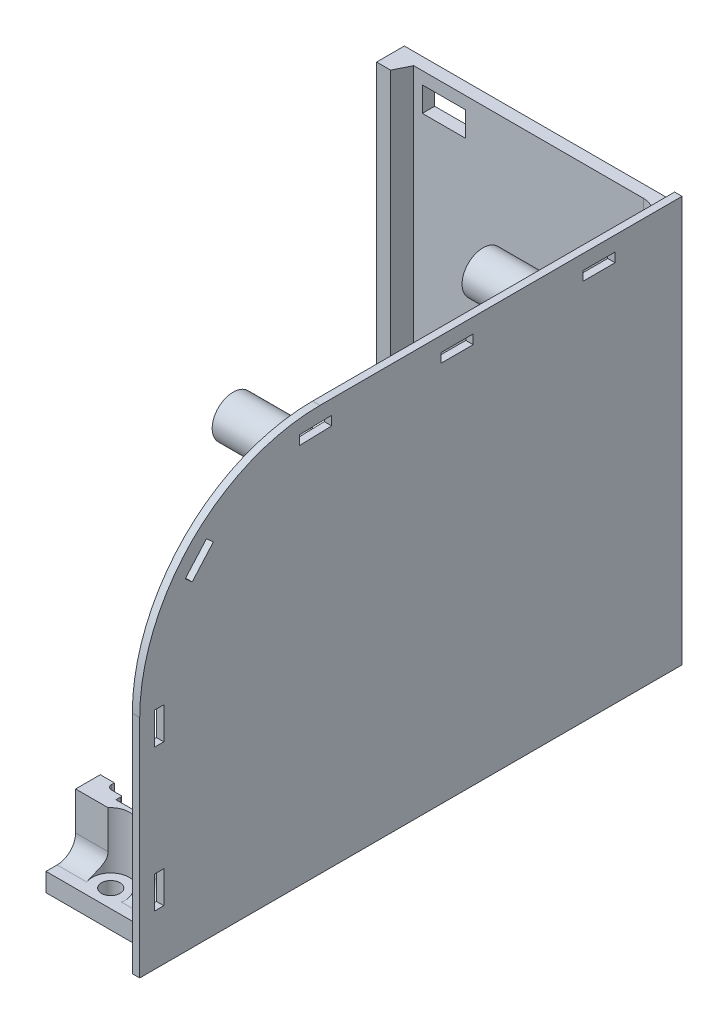
from build123d import *

# Parameters (mm, degrees)
EXTRUDE_1_DEPTH     = 2
EXTRUDE_2_DEPTH     = 1.2
SKETCH_4_R          = 1.55
EXTRUDE_3_DEPTH     = 4
EXTRUDE_START       = 3
SKETCH_4_3_R        = 1.55
EXTRUDE_4_DEPTH     = 4
FILLET_1_R          = 3
SKETCH_5_W          = 3.5
SKETCH_5_H          = 2.5
EXTRUDE_5_DEPTH     = 59.375418161
SKETCH_9_W          = 7
SKETCH_9_H          = 4
CUT_EXTRUDE_3_DEPTH = 2
OTHER_START         = -350.004341608
OTHER_1_OUTLINE_W   = 1.5
OTHER_1_OUTLINE_H   = 5.2
OTHER_1_OUTLINE_W_2 = 5.2
OTHER_1_OUTLINE_H_2 = 1.5
OTHER_1_DEPTH       = 1.2
SKETCH_10_R         = 3.4
SKETCH_10_R_2       = 1.4
EXTRUDE_6_DEPTH     = 13.8
EXTRUDE_7_DEPTH     = 2.4
CHAMFER_1_SIZE2     = 1.219331471
CHAMFER_1_SIZE      = 2.5
EXTRUDE_9_DEPTH     = 15.389983971
SKETCH_15_R         = 1.5
CUT_EXTRUDE_4_DEPTH = 407.679532375
FILLET_2_R          = 3
SKETCH_16_R         = 3
CUT_EXTRUDE_5_DEPTH = 408.922716855


# Read off the part's stored shape, not the designer's step: Отступ1
# Some blends are built 0.0001 mm under size
with BuildPart() as part:
    # Эскиз2 → Бобышка-Вытянуть1 (new body)
    with BuildSketch(Plane.XY.offset(0.1)):
        Polygon((-376.904341608, -14.952219826), (-393.804341608, -14.952219826), (-393.804341608, 44.423198335), (-348.804341608, 44.423198335), (-348.804341608, -19.952219826), (-376.904341608, -19.952219826), align=None)
    extrude(amount=EXTRUDE_1_DEPTH)

    # Эскиз3 → Бобышка-Вытянуть2 (add)
    with BuildSketch(Plane(origin=(-348.804341608, 0, 0), x_dir=(0, 0, -1), z_dir=(1, 0, 0))):
        with BuildLine():
            Line((-0.1, -19.952219826), (-0.1, 45.823198335))
            Line((-0.1, 45.823198335), (-58.7849644, 45.823198335))
            ThreePointArc((-58.7849644, 45.823198335), (-79.43775717, 37.268531468), (-87.992424037, 16.615738698))
            Line((-87.992424037, 16.615738698), (-87.992424037, -19.952219826))
            Line((-87.992424037, -19.952219826), (-0.1, -19.952219826))
        make_face()
    extrude(amount=-EXTRUDE_2_DEPTH)

    # Эскиз4 → Бобышка-Вытянуть3 (add)
    with BuildSketch(Plane(origin=(0, -17.952219826, 0), x_dir=(1, 0, 0), z_dir=(0, 1, 0))):
        with BuildLine():
            Line((-357.604341608, -2.1), (-357.604341608, -5.7))
            ThreePointArc((-357.604341608, -5.7), (-356.608504664, -8.104163056), (-354.204341608, -9.1))
            Line((-354.204341608, -9.1), (-350.004341608, -9.1))
            Line((-350.004341608, -9.1), (-350.004341608, -2.1))
            Line((-350.004341608, -2.1), (-357.604341608, -2.1))
        make_face()
        with Locations(Location((-354.204341608, -5.7, 0), (0, 0, 270))):
            Circle(SKETCH_4_R, mode=Mode.SUBTRACT)
    extrude(amount=EXTRUDE_3_DEPTH)

    # Эскиз4<3> → Бобышка-Вытянуть4 (add)
    with BuildSketch(Plane(origin=(0, -17.952219826, 0), x_dir=(1, 0, 0), z_dir=(0, 1, 0)).offset(EXTRUDE_START)):
        with BuildLine():
            Line((-390.304341608, -5.7), (-390.304341608, -2.1))
            Line((-390.304341608, -2.1), (-381.365657691, -2.1))
            Line((-381.365657691, -2.1), (-383.84844185, -7.190461899))
            ThreePointArc((-383.84844185, -7.190461899), (-387.669175192, -9.01285822), (-390.304341608, -5.7))
        make_face()
        with Locations(Location((-386.904341608, -5.7, 0), (0, 0, 180))):
            Circle(SKETCH_4_3_R, mode=Mode.SUBTRACT)
    extrude(amount=EXTRUDE_4_DEPTH)

    # Скругление1
    fillet_1_edges = [part.edges().sort_by_distance(p)[0] for p in [
        (-350.004341608, -18.952219826, 2.1),
        (-350.004341608, 15.235489254, 2.1),
    ]]
    fillet(fillet_1_edges, radius=FILLET_1_R)

    # Эскиз5 → Бобышка-Вытянуть5 (add)
    with BuildSketch(Plane(origin=(0, 44.423198335, 0), x_dir=(1, 0, 0), z_dir=(0, 1, 0))):
        with Locations((-392.054341608, -3.35)):
            Rectangle(SKETCH_5_W, SKETCH_5_H)
    extrude(amount=-EXTRUDE_5_DEPTH)

    # Эскиз9 → Вырез-Вытянуть3 (cut)
    with BuildSketch(Plane(origin=(0, 0, 0.1), x_dir=(-1, 0, 0), z_dir=(0, 0, -1))):
        with Locations((385.390488384, 40.423198335)):
            Rectangle(SKETCH_9_W, SKETCH_9_H)
    extrude(amount=-CUT_EXTRUDE_3_DEPTH, mode=Mode.SUBTRACT)

    # Отступ1 outline → Отступ1 (cut)
    with BuildSketch(Plane.YZ.offset(OTHER_START)):
        with Locations((42.673198335, 13.546937644)):
            Rectangle(OTHER_1_OUTLINE_W, OTHER_1_OUTLINE_H)
        with Locations((42.673198335, 36.546937644)):
            Rectangle(OTHER_1_OUTLINE_W, OTHER_1_OUTLINE_H)
        Polygon((41.843105902, 62.072434127), (41.984560077, 56.874358452), (43.484004983, 56.915162541), (43.342550808, 62.113238216), align=None)
        Polygon((31.397725301, 79.490528515), (35.298941914, 76.052431812), (36.290700579, 77.177782758), (32.389483966, 80.615879461), align=None)
        with Locations((13.847780174, 84.842424037)):
            Rectangle(OTHER_1_OUTLINE_W_2, OTHER_1_OUTLINE_H_2)
        with Locations((-9.152219826, 84.842424037)):
            Rectangle(OTHER_1_OUTLINE_W_2, OTHER_1_OUTLINE_H_2)
    extrude(amount=OTHER_1_DEPTH, mode=Mode.SUBTRACT)

    # Эскиз10 → Бобышка-Вытянуть6 (add)
    # profile 1 of 2: a face of its own
    with BuildSketch(Plane.ZY.offset(350.004341608)):
        with Locations(Location((57.85, 36.323198334, 0), (0, 0, 180))):
            Circle(SKETCH_10_R)
        with Locations(Location((57.85, 36.323198334, 0), (0, 0, 180))):
            Circle(SKETCH_10_R_2, mode=Mode.SUBTRACT)
    # profile 2 of 2: a face of its own
    with BuildSketch(Plane.ZY.offset(350.004341608)):
        with Locations(Location((17.35, 36.323198334, 0), (0, 0, 180))):
            Circle(SKETCH_10_R)
        with Locations(Location((17.35, 36.323198334, 0), (0, 0, 180))):
            Circle(SKETCH_10_R_2, mode=Mode.SUBTRACT)
    extrude(amount=EXTRUDE_6_DEPTH)

    # Эскиз12 → Бобышка-Вытянуть7 (add)
    with BuildSketch(Plane.ZY.offset(350.004341608)):
        with BuildLine():
            Line((77.792424037, 16.615738698), (77.792424037, -19.952219826))
            Line((77.792424037, -19.952219826), (79.792424037, -19.952219826))
            Line((79.792424037, -19.952219826), (79.792424037, 16.615738698))
            ThreePointArc((79.792424037, 16.615738698), (73.639481564, 31.470255863), (58.7849644, 37.623198335))
            Line((58.7849644, 37.623198335), (0.1, 37.623198335))
            Line((0.1, 37.623198335), (0.1, 35.623198335))
            Line((0.1, 35.623198335), (58.7849644, 35.623198335))
            ThreePointArc((58.7849644, 35.623198335), (72.225268002, 30.0560423), (77.792424037, 16.615738698))
        make_face()
    extrude(amount=EXTRUDE_7_DEPTH)

    # Фаска1
    chamfer_1_edges = [part.edges().sort_by_distance(p)[0] for p in [
        (-390.304341608, 16.735489254, 4.6),
    ]]
    chamfer_1_side = [part.faces().sort_by_distance(p)[0] for p in [
        (-390.304341608, 16.735489254, 4.575613371),
    ]]
    chamfer(chamfer_1_edges, length=CHAMFER_1_SIZE - 0.0001, length2=CHAMFER_1_SIZE2 - 0.0001, reference=chamfer_1_side[0])  # a hair under: the kernel refuses the full size

    # Эскиз14 → Бобышка-Вытянуть9 (add)
    with BuildSketch(Plane.ZY.offset(350.004341608)):
        Polygon((77.792424037, -16.979951829), (86.592424037, -16.979951829), (86.592424037, -13.979951829), (81.792424037, -13.979951829), (81.792424037, -4.809951829), (77.792424037, -4.809951829), align=None)
    extrude(amount=EXTRUDE_9_DEPTH)

    # Эскиз15 → Вырез-Вытянуть4 (cut, through all)
    with BuildSketch(Plane(origin=(0, -4.809951829, 0), x_dir=(1, 0, 0), z_dir=(0, 1, 0))):
        with Locations(Location((-357.804325578, -83.692424037, 0), (0, 0, 270))):
            Circle(SKETCH_15_R)
        with BuildLine():
            Line((-363.104325578, -78.236115217), (-363.104325578, -76.736115217))
            Line((-363.104325578, -76.736115217), (-352.504325578, -76.736115217))
            Line((-352.504325578, -76.736115217), (-352.504325578, -78.236115217))
            ThreePointArc((-352.504325578, -78.236115217), (-352.738640153, -78.801800642), (-353.304325578, -79.036115217))
            Line((-353.304325578, -79.036115217), (-354.804325578, -79.036115217))
            ThreePointArc((-354.804325578, -79.036115217), (-354.945746935, -79.09469386), (-355.004325578, -79.236115217))
            Line((-355.004325578, -79.236115217), (-355.004325578, -80.036115217))
            Line((-355.004325578, -80.036115217), (-360.604325578, -80.036115217))
            Line((-360.604325578, -80.036115217), (-360.604325578, -79.236115217))
            ThreePointArc((-360.604325578, -79.236115217), (-360.662904222, -79.09469386), (-360.804325578, -79.036115217))
            Line((-360.804325578, -79.036115217), (-362.304325578, -79.036115217))
            ThreePointArc((-362.304325578, -79.036115217), (-362.870011003, -78.801800642), (-363.104325578, -78.236115217))
        make_face()
    extrude(amount=-CUT_EXTRUDE_4_DEPTH, mode=Mode.SUBTRACT)

    # Скругление2
    # the kernel refuses this fillet: 3 mm, written as the material it adds along each edge
    with BuildSketch(Plane(origin=(-350.004341608, -13.979951829, 81.792424037), x_dir=(0, 1, 0), z_dir=(-1, 0, 0))) as fillet_2_piece_1_section:
        with BuildLine():
            CenterArc((FILLET_2_R, -FILLET_2_R), FILLET_2_R, 90, 90)
            Line((0, -FILLET_2_R), (0, 0))
            Line((0, 0), (FILLET_2_R, 0))
        make_face()
    fillet_2_piece_1 = extrude(amount=15.389983971, mode=Mode.PRIVATE)
    fillet_2_piece_1 = fillet_2_piece_1 - Plane(origin=(-357.804325578, -11.764674138, 83.692424037), x_dir=(0, 0, 1), z_dir=(0, 1, 0)) * Cylinder(1.5, 43, mode=Mode.PRIVATE)
    add(fillet_2_piece_1)

    # Эскиз16 → Вырез-Вытянуть5 (cut, through all)
    with BuildSketch(Plane(origin=(0, -13.979951829, 0), x_dir=(1, 0, 0), z_dir=(0, 1, 0))):
        with Locations((-357.804325578, -83.692424037)):
            Circle(SKETCH_16_R)
    extrude(amount=CUT_EXTRUDE_5_DEPTH, mode=Mode.SUBTRACT)


solid = part.part
